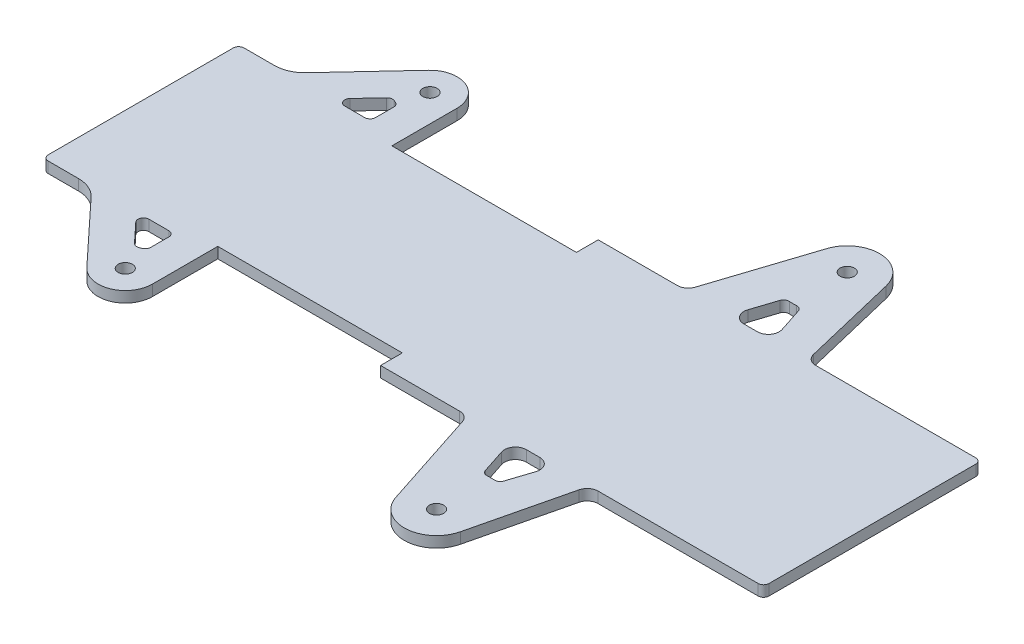
from build123d import *

# Parameters (mm, degrees)
SKETCH1_R           = 2.0828
BOSS_EXTRUDE1_DEPTH = 3.175
FILLET1_R           = 1.5875
FILLET2_R           = 3.175
FILLET3_R           = 1.5875
FILLET4_R           = 3.175
FILLET5_R           = 8.89
FILLET6_R           = 1.5875
FILLET7_R           = 1.5875
FILLET8_R           = 1.5875


with BuildPart() as part:
    # Sketch1 → Boss-Extrude1 (new body)
    with BuildSketch(Plane(origin=(0, 0, 0), x_dir=(1, 0, 0), z_dir=(0, 1, 0))):
        with BuildLine():
            Line((26.924, -25.4), (-26.924, -25.4))
            Line((-26.924, -25.4), (-26.924, -44.45))
            ThreePointArc((-26.924, -44.45), (-31.952659905, -51.835293193), (-40.667006123, -49.862947894))
            Line((-40.667006123, -49.862947894), (-60.5155, -28.575))
            Line((-60.5155, -28.575), (-74.803, -28.575))
            Line((-74.803, -28.575), (-74.803, 28.575))
            Line((-74.803, 28.575), (-60.5155, 28.575))
            Line((-60.5155, 28.575), (-40.667006123, 49.862947894))
            ThreePointArc((-40.667006123, 49.862947894), (-31.952659905, 51.835293193), (-26.924, 44.45))
            Line((-26.924, 44.45), (-26.924, 28.575))
            Line((-26.924, 28.575), (-26.924, 25.4))
            Line((-26.924, 25.4), (26.924, 25.4))
            Line((26.924, 25.4), (26.924, 31.75))
            Line((26.924, 31.75), (52.324, 31.75))
            Line((52.324, 31.75), (62.607581289, 63.240132856))
            ThreePointArc((62.607581289, 63.240132856), (72.010560326, 69.32064995), (80.585058538, 62.118797179))
            Line((80.585058538, 62.118797179), (87.884, 31.75))
            Line((87.884, 31.75), (138.684, 31.75))
            Line((138.684, 31.75), (138.684, -31.75))
            Line((138.684, -31.75), (87.884, -31.75))
            Line((87.884, -31.75), (80.585058538, -62.118797179))
            ThreePointArc((80.585058538, -62.118797179), (72.010560326, -69.32064995), (62.607581289, -63.240132856))
            Line((62.607581289, -63.240132856), (52.324, -31.75))
            Line((52.324, -31.75), (26.924, -31.75))
            Line((26.924, -31.75), (26.924, -25.4))
        make_face()
        with Locations((71.4240126, 59.9169998)):
            Circle(SKETCH1_R, mode=Mode.SUBTRACT)
        with Locations((-34.8615, 44.45)):
            Circle(SKETCH1_R, mode=Mode.SUBTRACT)
        with Locations((71.4240126, -59.9169998)):
            Circle(SKETCH1_R, mode=Mode.SUBTRACT)
        with Locations((-34.8615, -44.45)):
            Circle(SKETCH1_R, mode=Mode.SUBTRACT)
        with BuildLine():
            Line((-47.492572128, -28.575), (-39.003982914, -37.679199341))
            ThreePointArc((-39.003982914, -37.679199341), (-37.770340095, -37.064706807), (-36.449, -36.672870067))
            Line((-36.449, -36.672870067), (-36.449, -28.575))
            Line((-36.449, -28.575), (-47.492572128, -28.575))
        make_face(mode=Mode.SUBTRACT)
        with BuildLine():
            Line((77.7740126, 31.75), (65.0740126, 31.75))
            Line((65.0740126, 31.75), (69.141994412, 44.206875103))
            ThreePointArc((69.141994412, 44.206875103), (71.4240126, 44.0419998), (73.706030788, 44.206875103))
            Line((73.706030788, 44.206875103), (77.7740126, 31.75))
        make_face(mode=Mode.SUBTRACT)
        with BuildLine():
            Line((77.7740126, -31.75), (73.706030788, -44.206875103))
            ThreePointArc((73.706030788, -44.206875103), (71.4240126, -44.0419998), (69.141994412, -44.206875103))
            Line((69.141994412, -44.206875103), (65.0740126, -31.75))
            Line((65.0740126, -31.75), (77.7740126, -31.75))
        make_face(mode=Mode.SUBTRACT)
        with BuildLine():
            Line((-47.492572128, 28.575), (-36.449, 28.575))
            Line((-36.449, 28.575), (-36.449, 36.672870067))
            ThreePointArc((-36.449, 36.672870067), (-37.770340095, 37.064706807), (-39.003982914, 37.679199341))
            Line((-39.003982914, 37.679199341), (-47.492572128, 28.575))
        make_face(mode=Mode.SUBTRACT)
    extrude(amount=BOSS_EXTRUDE1_DEPTH)

    # Fillet1
    fillet1_edges = [part.edges().sort_by_distance(p)[0] for p in [
        (73.706030788, 1.5875, -44.206875103),
        (69.141994412, 1.5875, -44.206875103),
        (73.706030788, 1.5875, 44.206875103),
        (69.141994412, 1.5875, 44.206875103),
    ]]
    fillet(fillet1_edges, radius=FILLET1_R)

    # Fillet2
    fillet2_edges = [part.edges().sort_by_distance(p)[0] for p in [
        (77.7740126, 1.5875, 31.75),
        (65.0740126, 1.5875, 31.75),
        (77.7740126, 1.5875, -31.75),
        (65.0740126, 1.5875, -31.75),
    ]]
    fillet(fillet2_edges, radius=FILLET2_R)

    # Fillet3
    fillet3_edges = [part.edges().sort_by_distance(p)[0] for p in [
        (138.684, 1.5875, -31.75),
        (138.684, 1.5875, 31.75),
    ]]
    fillet(fillet3_edges, radius=FILLET3_R)

    # Fillet4
    fillet4_edges = [part.edges().sort_by_distance(p)[0] for p in [
        (52.324, 1.5875, -31.75),
        (87.884, 1.5875, -31.75),
        (87.884, 1.5875, 31.75),
        (52.324, 1.5875, 31.75),
    ]]
    fillet(fillet4_edges, radius=FILLET4_R)

    # Fillet5
    fillet5_edges = [part.edges().sort_by_distance(p)[0] for p in [
        (-60.5155, 1.5875, -28.575),
        (-60.5155, 1.5875, 28.575),
    ]]
    fillet(fillet5_edges, radius=FILLET5_R)

    # Fillet6
    fillet6_edges = [part.edges().sort_by_distance(p)[0] for p in [
        (-74.803, 1.5875, 28.575),
        (-74.803, 1.5875, -28.575),
    ]]
    fillet(fillet6_edges, radius=FILLET6_R)

    # Fillet7
    fillet7_edges = [part.edges().sort_by_distance(p)[0] for p in [
        (-36.449, 1.5875, -28.575),
        (-36.449, 1.5875, 28.575),
    ]]
    fillet(fillet7_edges, radius=FILLET7_R)

    # Fillet8
    fillet8_edges = [part.edges().sort_by_distance(p)[0] for p in [
        (-36.449, 1.5875, 36.672870067),
        (-39.003982914, 1.5875, 37.679199341),
        (-47.492572128, 1.5875, 28.575),
        (-36.449, 1.5875, -36.672870067),
        (-39.003982914, 1.5875, -37.679199341),
        (-47.492572128, 1.5875, -28.575),
    ]]
    fillet(fillet8_edges, radius=FILLET8_R)


solid = part.part
